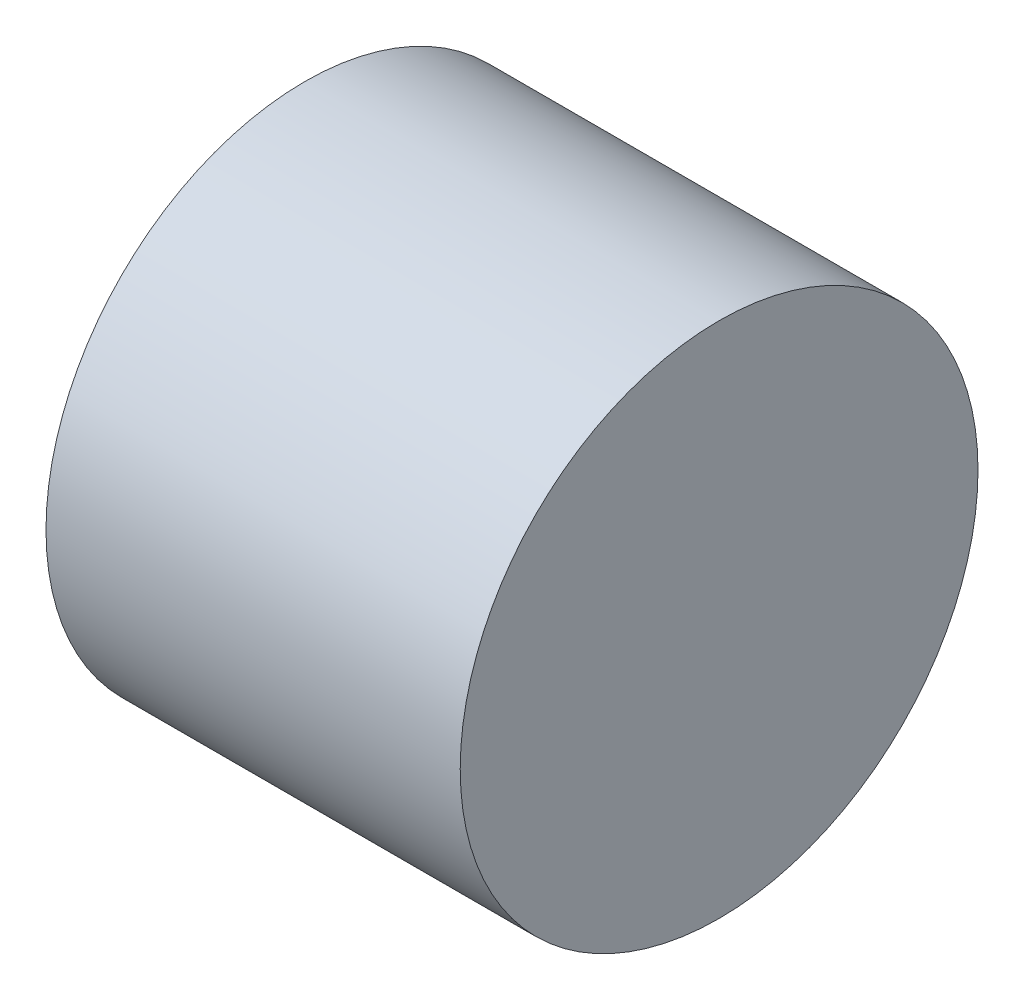
from build123d import *

# Parameters (mm, degrees)
SKETCH1_R           = 12.3825
BOSS_EXTRUDE1_DEPTH = 9.906


with BuildPart() as part:
    # Sketch1 → Boss-Extrude1 (new, symmetric)
    with BuildSketch(Plane(origin=(0, 0, 0), x_dir=(0, 0, -1), z_dir=(1, 0, 0))):
        Circle(SKETCH1_R)
    extrude(amount=BOSS_EXTRUDE1_DEPTH, both=True)


solid = part.part
